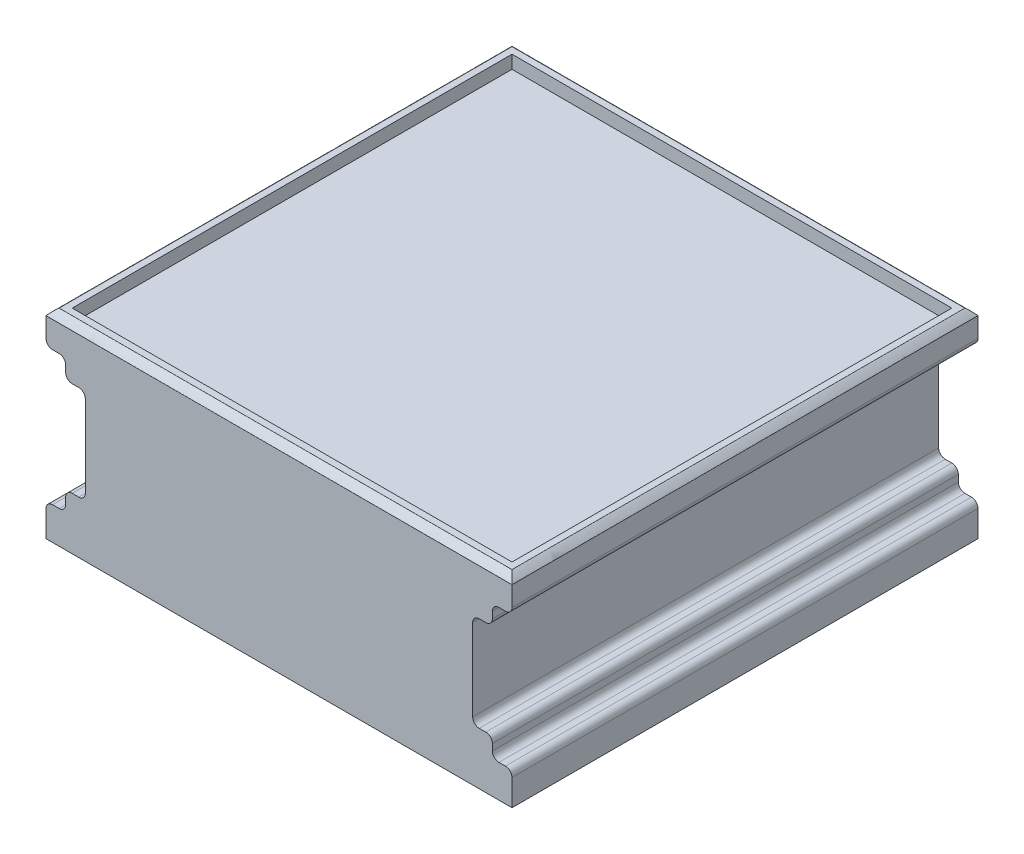
from build123d import *

# Parameters (mm, degrees)
SKETCH1_W           = 35.56
SKETCH1_H           = 35.56
BOSS_EXTRUDE1_DEPTH = 15.24
SKETCH2_W           = 33.56
SKETCH2_H           = 33.56
CUT_EXTRUDE1_DEPTH  = 1
SKETCH3_W           = 3
SKETCH3_H           = 7.24
CUT_EXTRUDE2_DEPTH  = 53.547928599
SKETCH4_W           = 1.5
SKETCH4_H           = 1.5
CUT_EXTRUDE3_DEPTH  = 53.547928599
CUT_EXTRUDE4_DEPTH  = 0.75
SKETCH6_W           = 19.56
SKETCH6_H           = 11.74
BOSS_EXTRUDE2_DEPTH = 0.75
FILLET1_R           = 0.5
FILLET2_SIZE        = 0.5


# Some blends are built 0.0001 mm under size
with BuildPart() as part:
    # Sketch1 → Boss-Extrude1 (new body)
    with BuildSketch(Plane(origin=(0, 0, 0), x_dir=(1, 0, 0), z_dir=(0, 1, 0))):
        with Locations((17.78, 17.78)):
            Rectangle(SKETCH1_W, SKETCH1_H)
    extrude(amount=BOSS_EXTRUDE1_DEPTH)

    # Sketch2 → Cut-Extrude1 (cut)
    with BuildSketch(Plane(origin=(0, 15.24, 0), x_dir=(1, 0, 0), z_dir=(0, 1, 0))):
        with Locations((17.78, 17.78)):
            Rectangle(SKETCH2_W, SKETCH2_H)
    extrude(amount=-CUT_EXTRUDE1_DEPTH, mode=Mode.SUBTRACT)

    # Sketch3 → Cut-Extrude2 (cut, through all)
    with BuildSketch(Plane.XY):
        with Locations((1.5, 7.62)):
            Rectangle(SKETCH3_W, SKETCH3_H)
        with Locations((34.06, 7.62)):
            Rectangle(SKETCH3_W, SKETCH3_H)
    extrude(amount=-CUT_EXTRUDE2_DEPTH, mode=Mode.SUBTRACT)

    # Sketch4 → Cut-Extrude3 (cut, through all)
    with BuildSketch(Plane(origin=(0, 0, -35.56), x_dir=(-1, 0, 0), z_dir=(0, 0, -1))):
        with Locations((-34.81, 11.99)):
            Rectangle(SKETCH4_W, SKETCH4_H)
        with Locations((-34.81, 3.25)):
            Rectangle(SKETCH4_W, SKETCH4_H)
        with Locations((-0.75, 3.25)):
            Rectangle(SKETCH4_W, SKETCH4_H)
        with Locations((-0.75, 11.99)):
            Rectangle(SKETCH4_W, SKETCH4_H)
    extrude(amount=-CUT_EXTRUDE3_DEPTH, mode=Mode.SUBTRACT)

    # Sketch5 → Cut-Extrude4 (cut)
    with BuildSketch(Plane(origin=(0, 0, -35.56), x_dir=(-1, 0, 0), z_dir=(0, 0, -1))):
        Polygon((-34.56, 14.49), (-34.56, 13.49), (-33.06, 13.49), (-33.06, 11.99), (-31.56, 11.99), (-31.56, 3.25), (-33.06, 3.25), (-33.06, 1.75), (-34.56, 1.75), (-34.56, 0.75), (-1, 0.75), (-1, 1.75), (-2.5, 1.75), (-2.5, 3.25), (-4, 3.25), (-4, 11.99), (-2.5, 11.99), (-2.5, 13.49), (-1, 13.49), (-1, 14.49), align=None)
    extrude(amount=-CUT_EXTRUDE4_DEPTH, mode=Mode.SUBTRACT)

    # Sketch6 → Boss-Extrude2 (add)
    with BuildSketch(Plane(origin=(0, 0, -34.81), x_dir=(-1, 0, 0), z_dir=(0, 0, -1))):
        with Locations((-17.78, 7.62)):
            Rectangle(SKETCH6_W, SKETCH6_H)
    extrude(amount=BOSS_EXTRUDE2_DEPTH)

    # Fillet1
    fillet1_edges = [part.edges().sort_by_distance(p)[0] for p in [
        (4, 11.99, -35.185),
        (1, 14.49, -35.185),
        (1, 13.49, -35.185),
        (2.5, 13.49, -35.185),
        (2.5, 11.99, -35.185),
        (1, 0.75, -35.185),
        (4, 3.25, -35.185),
        (2.5, 3.25, -35.185),
        (2.5, 1.75, -35.185),
        (1, 1.75, -35.185),
        (34.56, 0.75, -35.185),
        (34.56, 14.49, -35.185),
        (34.56, 13.49, -35.185),
        (33.06, 13.49, -35.185),
        (33.06, 11.99, -35.185),
        (31.56, 11.99, -35.185),
        (31.56, 3.25, -35.185),
        (33.06, 1.75, -35.185),
        (34.56, 1.75, -35.185),
        (33.06, 3.25, -35.185),
        (0, 2.5, -17.78),
        (1.5, 2.5, -17.78),
        (1.5, 4, -17.78),
        (3, 4, -17.78),
        (0, 12.74, -17.78),
        (1.5, 12.74, -17.78),
        (1.5, 11.24, -17.78),
        (3, 11.24, -17.78),
        (35.56, 12.74, -17.78),
        (34.06, 12.74, -17.78),
        (34.06, 11.24, -17.78),
        (32.56, 11.24, -17.78),
        (35.56, 2.5, -17.78),
        (34.06, 4, -17.78),
        (32.56, 4, -17.78),
        (34.06, 2.5, -17.78),
    ]]
    fillet(fillet1_edges, radius=FILLET1_R - 0.0001)  # a hair under: the kernel refuses the full size

    # Fillet2
    # a fillet whose section is not a circle: 0.5 mm, written as the material it takes off along each edge
    with BuildSketch(Plane(origin=(-1.25, 15.24, 0), x_dir=(0, -1, 0), z_dir=(1, 0, 0)), Plane(origin=(35.56, 15.24, 1.25), x_dir=(0, -1, 0), z_dir=(0, 0, -1))) as fillet2_piece_1:
        with BuildLine():
            Bezier((FILLET2_SIZE, 0), (0, 0), (0, FILLET2_SIZE), weights=[1, 0.052631579, 1])
            Line((0, FILLET2_SIZE), (0, 0))
            Line((0, 0), (FILLET2_SIZE, 0))
        make_face()
    extrude(amount=38.06, mode=Mode.SUBTRACT)
    with BuildSketch(Plane(origin=(0, 15.24, -36.81), x_dir=(1, 0, 0), z_dir=(0, 0, 1)), Plane(origin=(36.81, 15.24, -35.56), x_dir=(0, 0, 1), z_dir=(-1, 0, 0))) as fillet2_piece_2:
        with BuildLine():
            Bezier((FILLET2_SIZE, 0), (0, 0), (0, -FILLET2_SIZE), weights=[1, 0.052631579, 1])
            Line((0, -FILLET2_SIZE), (0, 0))
            Line((0, 0), (FILLET2_SIZE, 0))
        make_face()
    extrude(amount=38.06, mode=Mode.SUBTRACT)


solid = part.part
